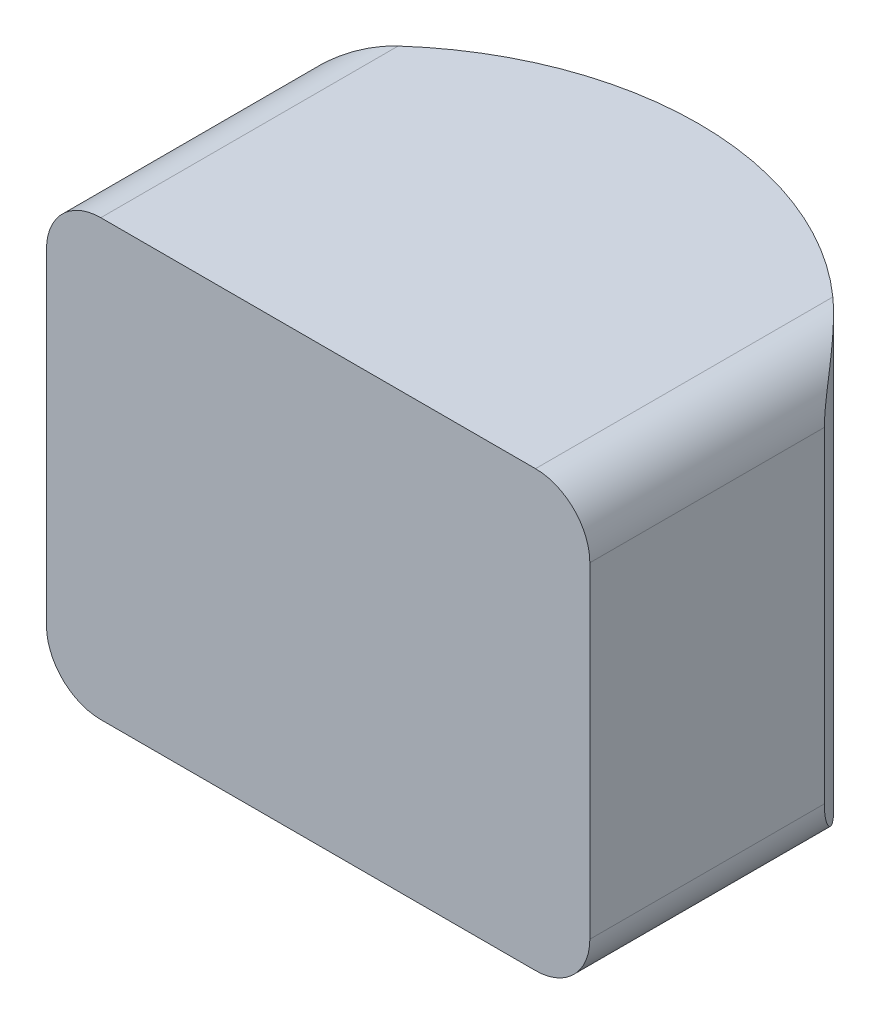
from build123d import *
from build123d.topology import SkipClean

# Parameters (mm, degrees)
SALIENTE_EXTRUIR1_DEPTH = 1
SALIENTE_EXTRUIR2_DEPTH = 7
CROQUIS4_W              = 21.763285414
CROQUIS4_H              = 20.505608116
CORTAR_EXTRUIR1_DEPTH   = 14


with BuildPart() as part:
    # Croquis1 → Saliente-Extruir1 (new body)
    with BuildSketch(Plane.XY):
        with BuildLine():
            Line((-4, 4), (4, 4))
            ThreePointArc((4, 4), (4.707106781, 3.707106781), (5, 3))
            Line((5, 3), (5, -3))
            ThreePointArc((5, -3), (4.707106781, -3.707106781), (4, -4))
            Line((4, -4), (-4, -4))
            ThreePointArc((-4, -4), (-4.707106781, -3.707106781), (-5, -3))
            Line((-5, -3), (-5, 3))
            ThreePointArc((-5, 3), (-4.707106781, 3.707106781), (-4, 4))
        make_face()
    extrude(amount=-SALIENTE_EXTRUIR1_DEPTH)

    # Croquis2 → Saliente-Extruir2 (add, symmetric)
    with BuildSketch(Plane(origin=(0, 0, 0), x_dir=(1, 0, 0), z_dir=(0, 1, 0))):
        with BuildLine():
            Line((0, 1), (-6, 1))
            ThreePointArc((-6, 1), (-4.242640667, 5.242640684), (0, 7))
            ThreePointArc((0, 7), (4.242640687, 5.242640687), (6, 1))
            Line((6, 1), (0, 1))
        make_face()
    extrude(amount=SALIENTE_EXTRUIR2_DEPTH, both=True)

    # Croquis4 → Cortar-Extruir1 (cut)
    with SkipClean():  # the faces are left unmerged after this step: merging them gives an invalid solid
        with BuildSketch(Plane.XY):
            with Locations((0.374231366, -0.207273628)):
                Rectangle(CROQUIS4_W, CROQUIS4_H)
            with BuildLine():
                Line((5, -3), (5, 3))
                ThreePointArc((5, 3), (4.707106781, 3.707106781), (4, 4))
                Line((4, 4), (-4, 4))
                ThreePointArc((-4, 4), (-4.707106781, 3.707106781), (-5, 3))
                Line((-5, 3), (-5, -3))
                ThreePointArc((-5, -3), (-4.707106781, -3.707106781), (-4, -4))
                Line((-4, -4), (4, -4))
                ThreePointArc((4, -4), (4.707106781, -3.707106781), (5, -3))
            make_face(mode=Mode.SUBTRACT)
        extrude(amount=-CORTAR_EXTRUIR1_DEPTH, mode=Mode.SUBTRACT)
    add(part.part.scale(1), mode=Mode.REPLACE)  # the faces are merged on a copy


solid = part.part
